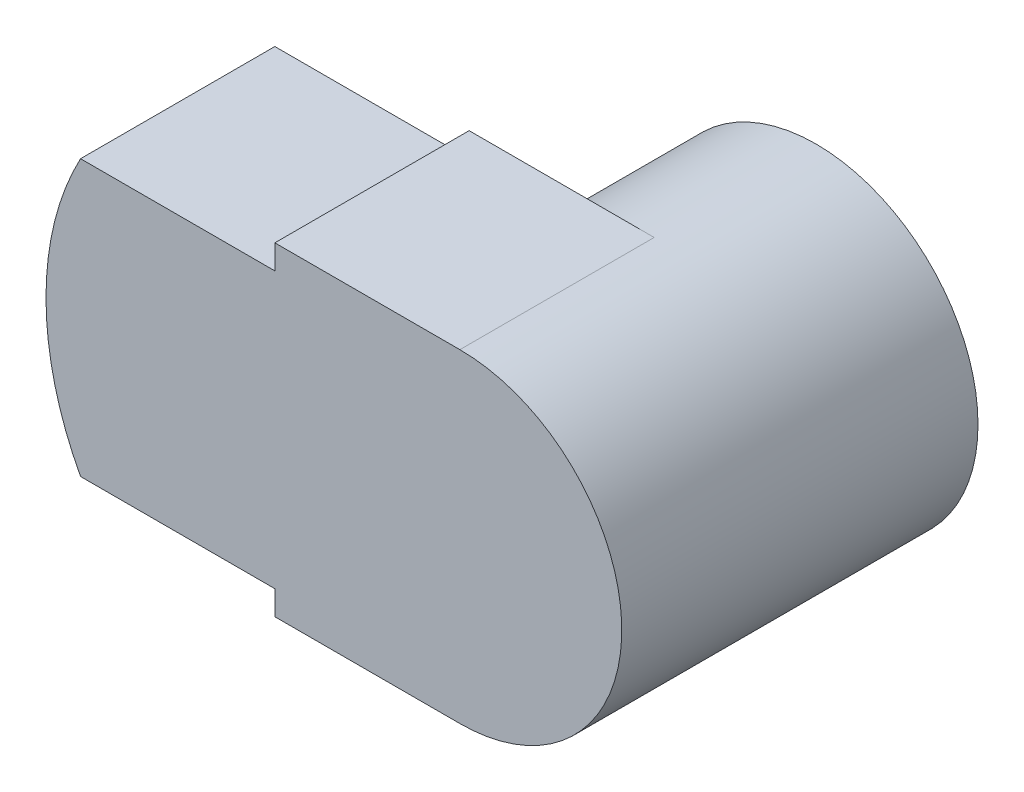
from build123d import *

# Parameters (mm, degrees)
ESQUISSE1_R        = 10
BOSS_EXTRU_1_DEPTH = 10
BOSS_EXTRU_4_DEPTH = 12
COQUE1_START       = 11
COQUE1_DEPTH       = 10
COQUE1_START_2     = 1
COQUE1_2_OUTLINE_R = 9
COQUE1_2_DEPTH     = 10


# Read off the part's stored shape, not the designer's step: Coque1
with BuildPart() as part:
    # Esquisse1 → Boss.-Extru.1 (new body)
    with BuildSketch(Plane.XY):
        Circle(ESQUISSE1_R)
    extrude(amount=BOSS_EXTRU_1_DEPTH)

    # Esquisse5 → Boss.-Extru.4 (add)
    with BuildSketch(Plane.XY.offset(10)):
        with BuildLine():
            Line((-11.427841592, -10), (0, -10))
            ThreePointArc((0, -10), (10, 0), (0, 10))
            Line((0, 10), (-11.427841592, 10))
            Line((-11.427841592, 10), (-11.427841592, 8.5))
            Line((-11.427841592, 8.5), (-23.427841592, 8.5))
            ThreePointArc((-23.427841592, 8.5), (-25.561840174, 0), (-23.427841592, -8.5))
            Line((-23.427841592, -8.5), (-11.427841592, -8.5))
            Line((-11.427841592, -8.5), (-11.427841592, -10))
        make_face()
    extrude(amount=BOSS_EXTRU_4_DEPTH)

    # Coque1 outline → Coque1 (cut)
    with BuildSketch(Plane.XY.offset(COQUE1_START)):
        with BuildLine():
            ThreePointArc((0, -9), (9, 0), (0, 9))
            Line((0, 9), (-10.427841592, 9))
            Line((-10.427841592, 9), (-10.427841592, 7.5))
            Line((-10.427841592, 7.5), (-23.924439446, 7.5))
            ThreePointArc((-23.924439446, 7.5), (-25.561840174, 0), (-23.924439446, -7.5))
            Line((-23.924439446, -7.5), (-10.427841592, -7.5))
            Line((-10.427841592, -7.5), (-10.427841592, -9))
            Line((-10.427841592, -9), (0, -9))
        make_face()
    extrude(amount=COQUE1_DEPTH, mode=Mode.SUBTRACT)

    # Coque1 2 outline → Coque1 2 (cut)
    with BuildSketch(Plane.XY.offset(COQUE1_START_2)):
        Circle(COQUE1_2_OUTLINE_R)
    extrude(amount=COQUE1_2_DEPTH, mode=Mode.SUBTRACT)


solid = part.part
